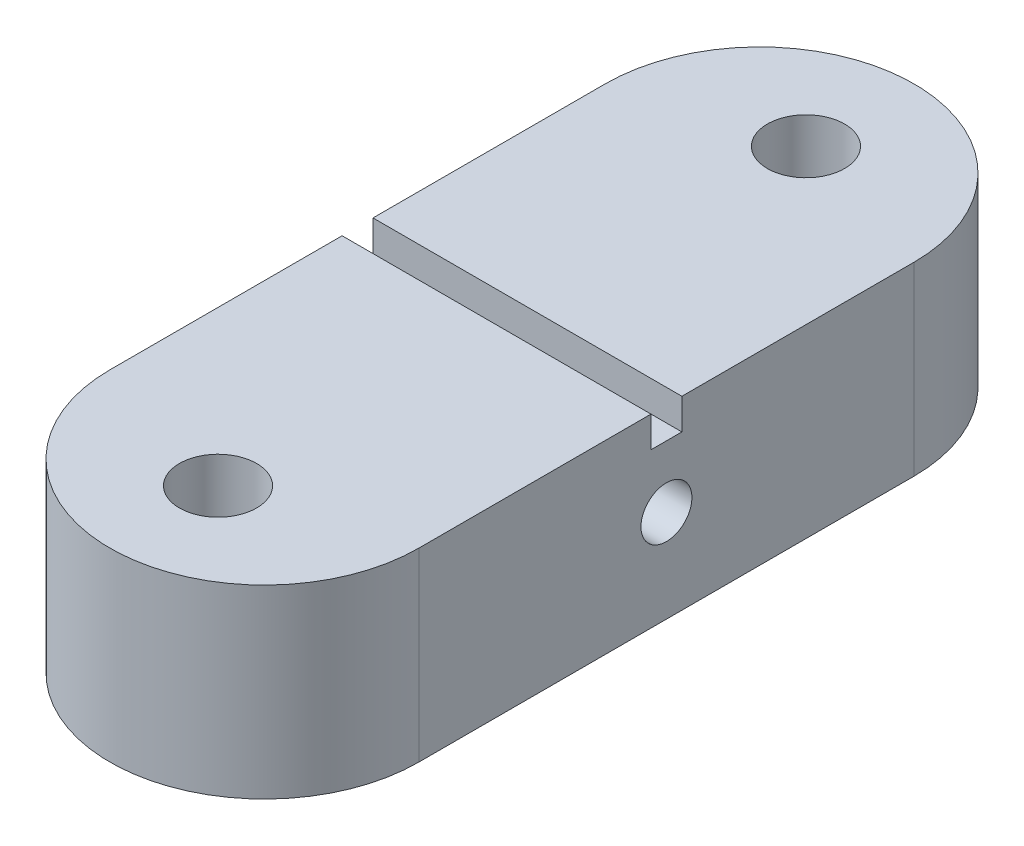
from build123d import *

# Parameters (mm, degrees)
SKETCH1_W               = 20
SKETCH1_H               = 12
BOSS_EXTRUDE1_DEPTH     = 26.035
M6X1_0_TAPPED_HOLE1_D   = 5
DELETEFACE1_START       = -6
DELETEFACE1_OUTLINE_R   = 2.5
DELETEFACE1_DEPTH       = 12
CUT_EXTRUDE1_DEPTH      = 29.527552033
CUT_EXTRUDE1_DEPTH_BACK = 29.527552033
SKETCH4_W               = 2
SKETCH4_H               = 2
M4X0_7_TAPPED_HOLE1_D   = 3.3
FILLET1_RADIUS          = 10
FILLET1_LENGTH          = 12
FILLET2_RADIUS          = 10
FILLET2_LENGTH          = 12


# Read off the part's stored shape, not the designer's step: DeleteFace1
with BuildPart() as part:
    # Sketch1 → Boss-Extrude1 (new, symmetric)
    with BuildSketch(Plane.XY):
        Rectangle(SKETCH1_W, SKETCH1_H)
    extrude(amount=BOSS_EXTRUDE1_DEPTH, both=True)

    # M6x1.0 Tapped Hole1 (through all)
    with Locations(Plane(origin=(0, 6, 0), x_dir=(1, 0, 0), z_dir=(0, 1, 0))):
        with Locations((0, -19.035), (0, 0), (0, 19.035)):
            Hole(M6X1_0_TAPPED_HOLE1_D / 2)

    # DeleteFace1 outline → DeleteFace1 (add)
    with BuildSketch(Plane(origin=(0, 0, 0), x_dir=(1, 0, 0), z_dir=(0, 1, 0)).offset(DELETEFACE1_START)):
        Circle(DELETEFACE1_OUTLINE_R)
    extrude(amount=DELETEFACE1_DEPTH)

    # Sketch4 → Cut-Extrude1 (cut, two sides: drawn at the far end of the back side and taken through both)
    with BuildSketch(Plane(origin=(0, 0, 0), x_dir=(0, 0, -1), z_dir=(1, 0, 0)).offset(-CUT_EXTRUDE1_DEPTH_BACK)):
        with Locations((0, 5)):
            Rectangle(SKETCH4_W, SKETCH4_H)
    extrude(amount=CUT_EXTRUDE1_DEPTH + CUT_EXTRUDE1_DEPTH_BACK, mode=Mode.SUBTRACT)

    # M4x0.7 Tapped Hole1 (through all)
    with Locations(Plane.ZY.offset(10)):
        with Locations((0, 0)):
            Hole(M4X0_7_TAPPED_HOLE1_D / 2)

    # Fillet1: full round fillet: the end face becomes a half cylinder, R = half its width
    fillet1_face = Plane((0, 0, -26.035), x_dir=(0, -1, 0), z_dir=(0, 0, -1))  # on the end face: x along it, z out of the body
    fillet1_slab = fillet1_face.offset(-FILLET1_RADIUS / 2) * Box(FILLET1_LENGTH, 2 * FILLET1_RADIUS, FILLET1_RADIUS, mode=Mode.PRIVATE)  # the body's end, R deep
    fillet1_round = Plane((0, 0, -16.035), x_dir=(0, 0, -1), z_dir=(0, -1, 0)) * Cylinder(FILLET1_RADIUS, FILLET1_LENGTH, mode=Mode.PRIVATE)  # its axis R under the face
    add(fillet1_slab - fillet1_round, mode=Mode.SUBTRACT)

    # Fillet2: full round fillet: the end face becomes a half cylinder, R = half its width
    fillet2_face = Plane((0, 0, 26.035), x_dir=(0, 1, 0), z_dir=(0, 0, 1))  # on the end face: x along it, z out of the body
    fillet2_slab = fillet2_face.offset(-FILLET2_RADIUS / 2) * Box(FILLET2_LENGTH, 2 * FILLET2_RADIUS, FILLET2_RADIUS, mode=Mode.PRIVATE)  # the body's end, R deep
    fillet2_round = Plane((0, 0, 16.035), x_dir=(0, 0, 1), z_dir=(0, 1, 0)) * Cylinder(FILLET2_RADIUS, FILLET2_LENGTH, mode=Mode.PRIVATE)  # its axis R under the face
    add(fillet2_slab - fillet2_round, mode=Mode.SUBTRACT)


solid = part.part
